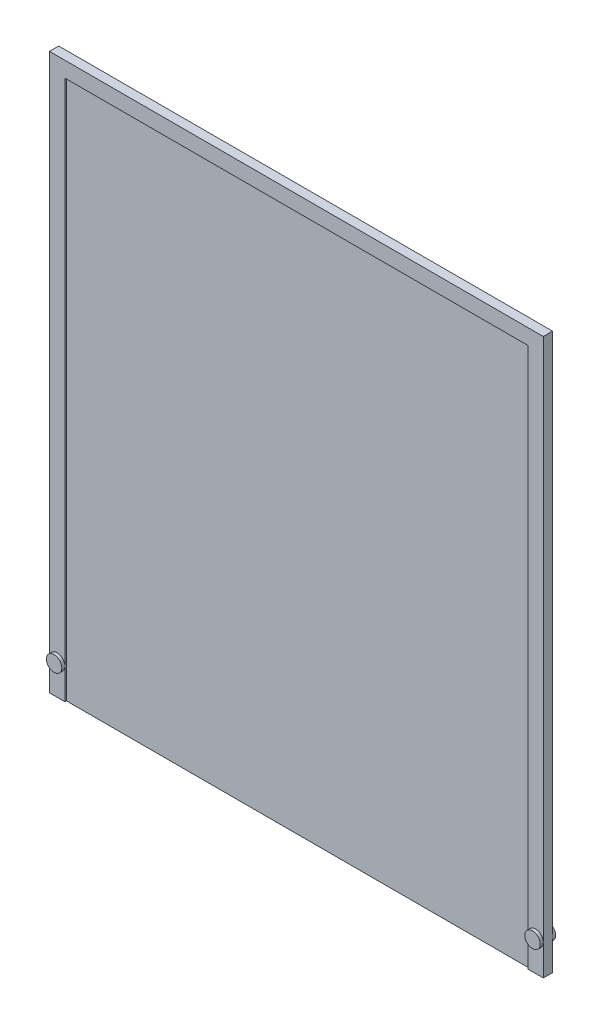
from build123d import *

# Parameters (mm, degrees)
SKETCH_1_W          = 160
SKETCH_1_H          = 180
EXTRUDE_1_DEPTH     = 1.5
SKETCH_2_W          = 150
SKETCH_2_H          = 175
CUT_EXTRUDE_1_DEPTH = 0.5
SKETCH_3_R          = 2.5
EXTRUDE_2_DEPTH     = 2.5


with BuildPart() as part:
    # 草图1 → 凸台-拉伸1 (new, symmetric)
    with BuildSketch(Plane.XY):
        Rectangle(SKETCH_1_W, SKETCH_1_H)
    extrude(amount=EXTRUDE_1_DEPTH, both=True)

    # 草图2 → 切除-拉伸1 (cut)
    with BuildSketch(Plane.XY.offset(1.5)):
        with Locations((0, -2.5)):
            Rectangle(SKETCH_2_W, SKETCH_2_H)
    extrude(amount=-CUT_EXTRUDE_1_DEPTH, mode=Mode.SUBTRACT)

    # 草图3 → 凸台-拉伸2 (add, symmetric)
    with BuildSketch(Plane.XY):
        with Locations((-77.5, -80)):
            Circle(SKETCH_3_R)
        with Locations((77.5, -80)):
            Circle(SKETCH_3_R)
    extrude(amount=EXTRUDE_2_DEPTH, both=True)


solid = part.part
